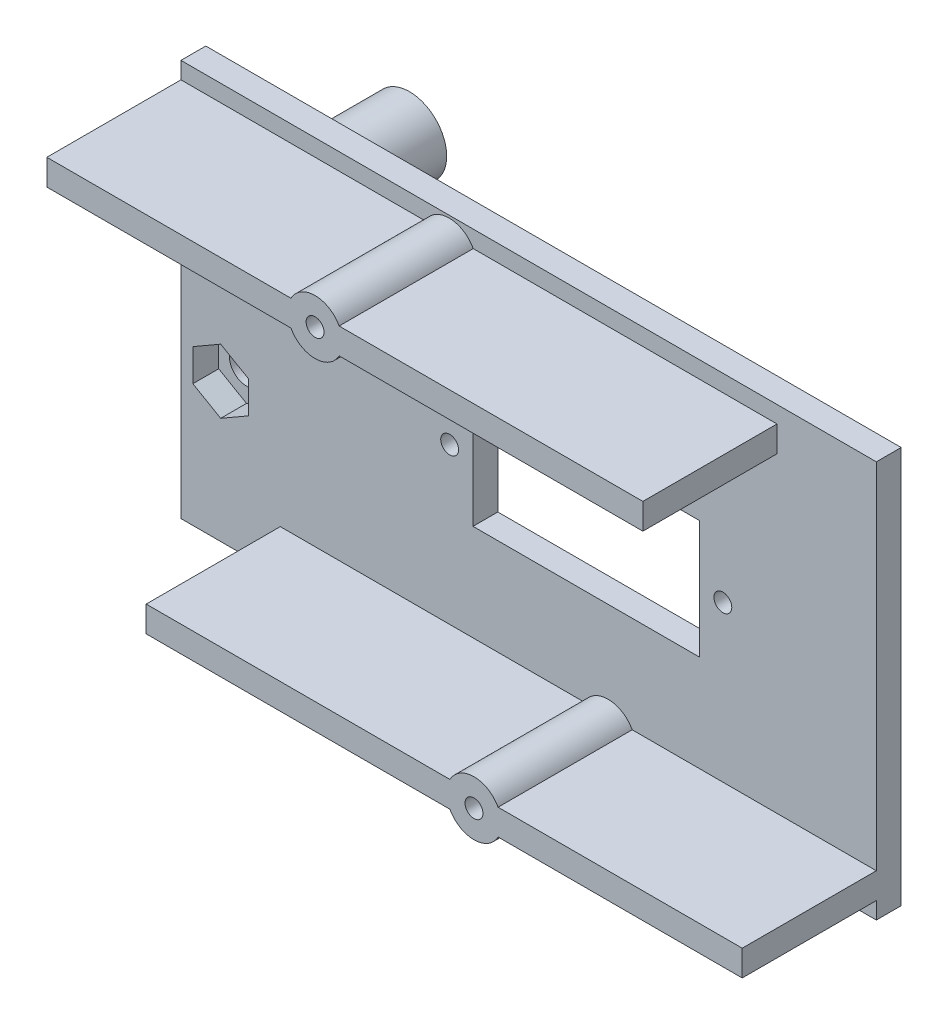
from build123d import *

# Parameters (mm, degrees)
BOSS_EXTRUDE1_START     = -2.5
SKETCH1_W               = 70
SKETCH1_H               = 39.95
BOSS_EXTRUDE1_DEPTH     = 2.5
SKETCH2_W               = 60
SKETCH2_H               = 2.6
BOSS_EXTRUDE2_DEPTH     = 13.5
SKETCH3_W               = 60
SKETCH3_H               = 2.6
BOSS_EXTRUDE3_DEPTH     = 13.5
SKETCH4_R               = 2.75
BOSS_EXTRUDE4_DEPTH     = 13.5
BOSS_EXTRUDE5_START     = -19
SKETCH5_R               = 3.75
BOSS_EXTRUDE5_DEPTH     = 16.5
CUT_EXTRUDE1_DEPTH      = 45.553345834
CUT_EXTRUDE1_DEPTH_BACK = 45.553345834
SKETCH6_W               = 22.8
SKETCH6_H               = 11.9
CUT_EXTRUDE2_DEPTH      = 45.553345834
CUT_EXTRUDE2_DEPTH_BACK = 45.553345834
SKETCH7_R               = 0.9
CUT_EXTRUDE3_DEPTH      = 45.553345834
CUT_EXTRUDE3_DEPTH_BACK = 45.553345834
SKETCH8_R               = 0.9
CUT_EXTRUDE4_DEPTH      = 45.553345834
CUT_EXTRUDE4_DEPTH_BACK = 45.553345834
SKETCH9_R               = 1.725
CUT_EXTRUDE5_START      = -2.6
CUT_EXTRUDE5_DEPTH      = 2.6


with BuildPart() as part:
    # Sketch1 → Boss-Extrude1 (new body)
    with BuildSketch(Plane.XY.offset(BOSS_EXTRUDE1_START)):
        Rectangle(SKETCH1_W, SKETCH1_H)
    extrude(amount=BOSS_EXTRUDE1_DEPTH)

    # Sketch2 → Boss-Extrude2 (add)
    with BuildSketch(Plane.XY):
        with Locations((-5, 16.975)):
            Rectangle(SKETCH2_W, SKETCH2_H)
    extrude(amount=BOSS_EXTRUDE2_DEPTH)

    # Sketch3 → Boss-Extrude3 (add)
    with BuildSketch(Plane.XY):
        with Locations((5, -16.975)):
            Rectangle(SKETCH3_W, SKETCH3_H)
    extrude(amount=BOSS_EXTRUDE3_DEPTH)

    # Sketch4 → Boss-Extrude4 (add)
    with BuildSketch(Plane.XY):
        with Locations((-8, 16.975)):
            Circle(SKETCH4_R)
        with Locations((8, -16.975)):
            Circle(SKETCH4_R)
    extrude(amount=BOSS_EXTRUDE4_DEPTH)

    # Sketch5 → Boss-Extrude5 (add)
    with BuildSketch(Plane.XY.offset(BOSS_EXTRUDE5_START)):
        with Locations((-31, 6)):
            Circle(SKETCH5_R)
        with Locations((-31, -6)):
            Circle(SKETCH5_R)
    extrude(amount=BOSS_EXTRUDE5_DEPTH)

    # Sketch6 → Cut-Extrude1 (cut, two sides: drawn at the far end of the back side and taken through both)
    with BuildSketch(Plane.XY.offset(-CUT_EXTRUDE1_DEPTH_BACK)):
        with Locations((5.8, 0)):
            Rectangle(SKETCH6_W, SKETCH6_H)
    extrude(amount=CUT_EXTRUDE1_DEPTH + CUT_EXTRUDE1_DEPTH_BACK, mode=Mode.SUBTRACT)

    # Sketch7 → Cut-Extrude2 (cut, two sides: drawn at the far end of the back side and taken through both)
    with BuildSketch(Plane.XY.offset(-CUT_EXTRUDE2_DEPTH_BACK)):
        with Locations((-7.95, 0)):
            Circle(SKETCH7_R)
        with Locations((19.55, 0)):
            Circle(SKETCH7_R)
    extrude(amount=CUT_EXTRUDE2_DEPTH + CUT_EXTRUDE2_DEPTH_BACK, mode=Mode.SUBTRACT)

    # Sketch8 → Cut-Extrude3 (cut, two sides: drawn at the far end of the back side and taken through both)
    with BuildSketch(Plane.XY.offset(-CUT_EXTRUDE3_DEPTH_BACK)):
        with Locations((-8, 16.975)):
            Circle(SKETCH8_R)
        with Locations((8, -16.975)):
            Circle(SKETCH8_R)
    extrude(amount=CUT_EXTRUDE3_DEPTH + CUT_EXTRUDE3_DEPTH_BACK, mode=Mode.SUBTRACT)

    # Sketch9 → Cut-Extrude4 (cut, two sides: drawn at the far end of the back side and taken through both)
    with BuildSketch(Plane.XY.offset(-CUT_EXTRUDE4_DEPTH_BACK)):
        with Locations((-31, 6)):
            Circle(SKETCH9_R)
        with Locations((-31, -6)):
            Circle(SKETCH9_R)
    extrude(amount=CUT_EXTRUDE4_DEPTH + CUT_EXTRUDE4_DEPTH_BACK, mode=Mode.SUBTRACT)

    # Sketch10 → Cut-Extrude5 (cut)
    with BuildSketch(Plane.XY.offset(CUT_EXTRUDE5_START)):
        Polygon((-28.2, 7.616580754), (-31, 9.233161507), (-33.8, 7.616580754), (-33.8, 4.383419246), (-31, 2.766838493), (-28.2, 4.383419246), align=None)
        Polygon((-28.2, -4.383419246), (-31, -2.766838493), (-33.8, -4.383419246), (-33.8, -7.616580754), (-31, -9.233161507), (-28.2, -7.616580754), align=None)
    extrude(amount=CUT_EXTRUDE5_DEPTH, mode=Mode.SUBTRACT)


solid = part.part
